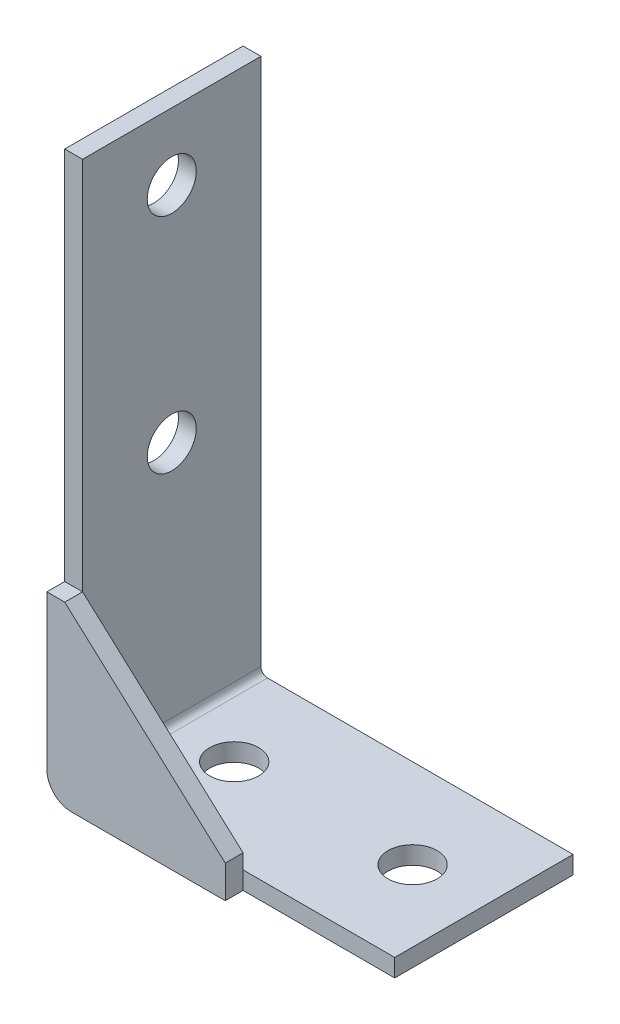
from build123d import *

# Parameters (mm, degrees)
SM_BASE_FLANGE_1_DEPTH  = 10
HOLE_WIZARD_5_5_5_5_1_D = 5.5
HOLE_WIZARD_5_5_5_5_2_D = 5.5
SM_START                = 2
SM_BASE_FLANGE_2_DEPTH  = 2


# Sheet-metal steps are written as plain solids
with BuildPart() as part:
    # Sketch 1 → 基体-法兰1 (new, symmetric)
    with BuildSketch(Plane.XY):
        with BuildLine():
            Line((0, 60), (0, 0.7366))
            ThreePointArc((0, 0.7366), (0.215745145, 0.215745145), (0.7366, 0))
            Line((0.7366, 0), (35, 0))
            Line((35, 0), (35, -2))
            Line((35, -2), (0.7366, -2))
            ThreePointArc((0.7366, -2), (-1.198468417, -1.198468417), (-2, 0.7366))
            Line((-2, 0.7366), (-2, 60))
            Line((-2, 60), (0, 60))
        make_face()
    extrude(amount=SM_BASE_FLANGE_1_DEPTH, both=True)

    # Ø5.5 (5.5) 直径孔1 (through all)
    with Locations(Plane(origin=(7, 0, 0), x_dir=(0, 0, 1), z_dir=(0, 1, 0))):
        with Locations((0, 0), (0, 20)):
            Hole(HOLE_WIZARD_5_5_5_5_1_D / 2)

    # Ø5.5 (5.5) 直径孔2 (through all)
    with Locations(Plane(origin=(-2, 52.5, 0), x_dir=(0, 0, -1), z_dir=(-1, 0, 0))):
        with Locations((0, 0), (0, 25)):
            Hole(HOLE_WIZARD_5_5_5_5_2_D / 2)


with BuildPart() as body_2:
    # 草图11 → 基体-法兰2 (new body)
    with BuildSketch(Plane.XY.offset(10).offset(SM_START)):
        with BuildLine():
            Line((18, -2), (18, 1.656389448))
            Line((18, 1.656389448), (0, 18))
            Line((0, 18), (-2, 18))
            Line((-2, 18), (-2, 0.7366))
            ThreePointArc((-2, 0.7366), (-1.198468417, -1.198468417), (0.7366, -2))
            Line((0.7366, -2), (18, -2))
        make_face()
    extrude(amount=-SM_BASE_FLANGE_2_DEPTH)


solid = Compound([part.part, body_2.part])
